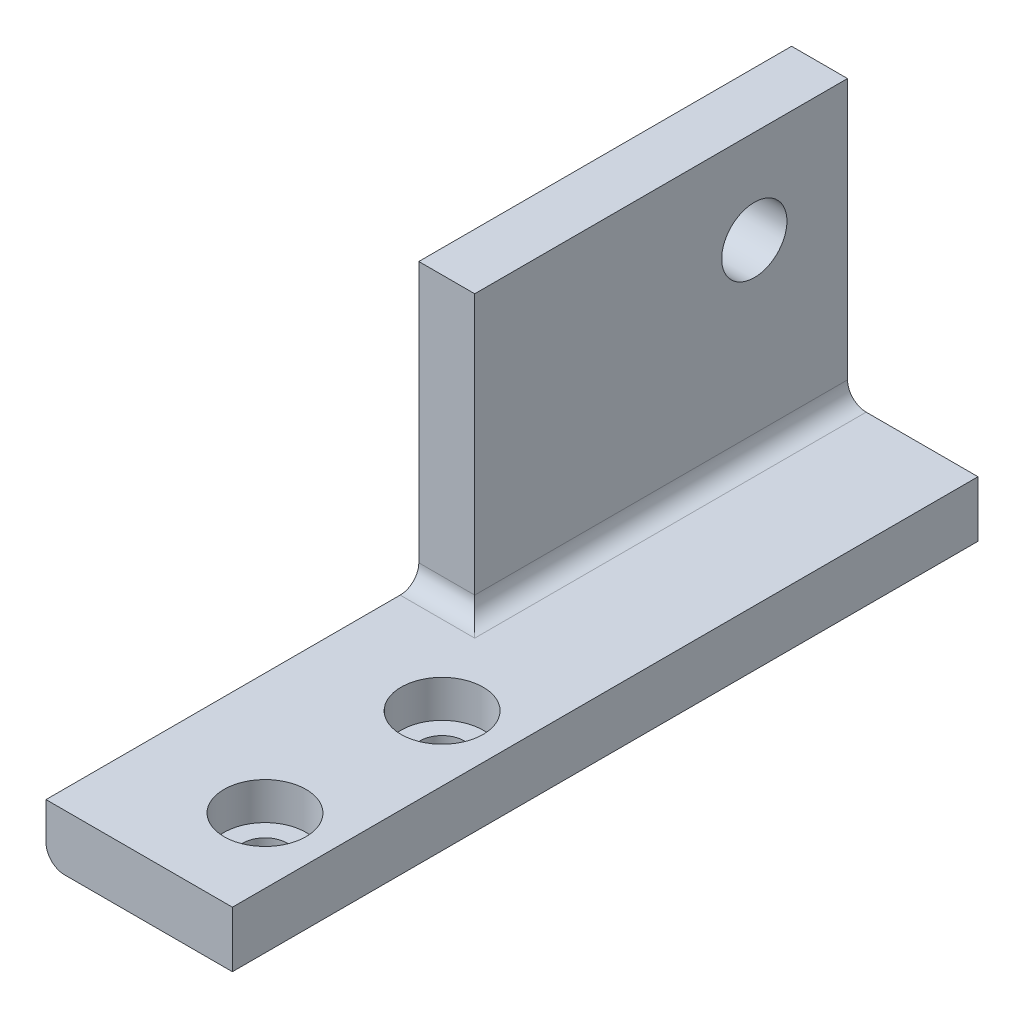
from build123d import *

# Parameters (mm, degrees)
SKETCH1_W                      = 10
SKETCH1_H                      = 20
SKETCH1_R                      = 1.175
BOSS_EXTRUDE1_DEPTH            = 3
CBORE_FOR_M2_SHCS1_D           = 2.4
CBORE_FOR_M2_SHCS1_CBORE_D     = 4.4
CBORE_FOR_M2_SHCS1_CBORE_DEPTH = 2
SKETCH6_W                      = 10
SKETCH6_H                      = 3
BOSS_EXTRUDE2_DEPTH            = 20
SKETCH8_W                      = 3
SKETCH8_H                      = 20
BOSS_EXTRUDE3_DEPTH            = 15
SKETCH9_R                      = 1.75
CUT_EXTRUDE1_DEPTH             = 45.418464629
FILLET1_R                      = 1
FILLET2_R                      = 1


with BuildPart() as part:
    # Sketch1 → Boss-Extrude1 (new body)
    with BuildSketch(Plane(origin=(0, 0, 0), x_dir=(1, 0, 0), z_dir=(0, 1, 0))):
        with Locations((5, 10)):
            Rectangle(SKETCH1_W, SKETCH1_H)
        with Locations((6.5, 5.25)):
            Circle(SKETCH1_R, mode=Mode.SUBTRACT)
        with Locations((6.5, 14.75)):
            Circle(SKETCH1_R, mode=Mode.SUBTRACT)
    extrude(amount=BOSS_EXTRUDE1_DEPTH)

    # CBORE for M2 SHCS1 (through all)
    with Locations(Plane(origin=(0, 3, 0), x_dir=(1, 0, 0), z_dir=(0, 1, 0))):
        with Locations((6.5, 14.75), (6.5, 5.25)):
            CounterBoreHole(CBORE_FOR_M2_SHCS1_D / 2, CBORE_FOR_M2_SHCS1_CBORE_D / 2, CBORE_FOR_M2_SHCS1_CBORE_DEPTH)

    # Sketch6 → Boss-Extrude2 (add)
    with BuildSketch(Plane(origin=(0, 0, -20), x_dir=(-1, 0, 0), z_dir=(0, 0, -1))):
        with Locations((-5, 1.5)):
            Rectangle(SKETCH6_W, SKETCH6_H)
    extrude(amount=BOSS_EXTRUDE2_DEPTH)

    # Sketch8 → Boss-Extrude3 (add)
    with BuildSketch(Plane(origin=(0, 3, 0), x_dir=(1, 0, 0), z_dir=(0, 1, 0))):
        with Locations((1.5, 30)):
            Rectangle(SKETCH8_W, SKETCH8_H)
    extrude(amount=BOSS_EXTRUDE3_DEPTH)

    # Sketch9 → Cut-Extrude1 (cut, through all)
    with BuildSketch(Plane(origin=(3, 0, 0), x_dir=(0, 0, -1), z_dir=(1, 0, 0))):
        with Locations((35, 13)):
            Circle(SKETCH9_R)
    extrude(amount=-CUT_EXTRUDE1_DEPTH, mode=Mode.SUBTRACT)

    # Fillet1
    fillet1_edges = [part.edges().sort_by_distance(p)[0] for p in [
        (1.5, 3, -20),
        (3, 3, -30),
    ]]
    fillet(fillet1_edges, radius=FILLET1_R)

    # Fillet2
    fillet2_edges = [part.edges().sort_by_distance(p)[0] for p in [
        (0, 0, -20),
    ]]
    fillet(fillet2_edges, radius=FILLET2_R)


solid = part.part
